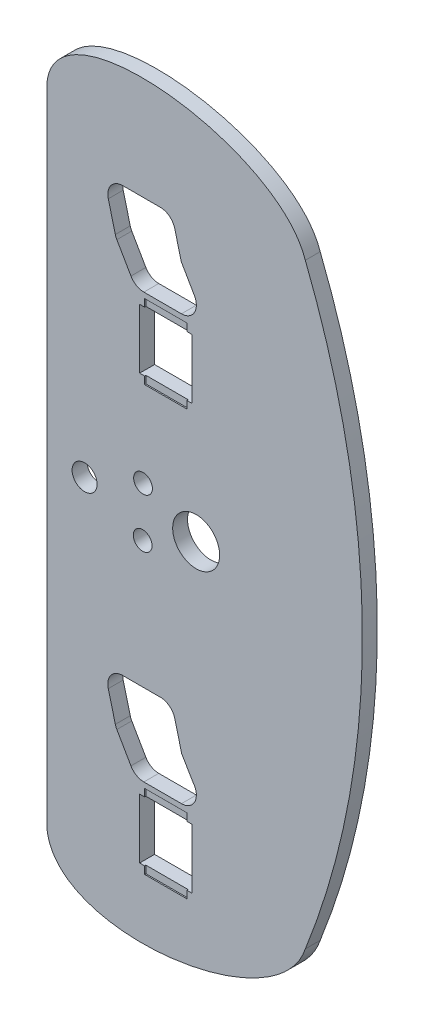
from build123d import *

# Parameters (mm, degrees)
SKETCH4_R           = 15.99946
BOSS_EXTRUDE6_DEPTH = 19.05
SKETCH5_W           = 53.975
SKETCH5_H           = 9.525
BOSS_EXTRUDE7_DEPTH = 17.4625


with BuildPart() as part:
    # Sketch4 → Boss-Extrude6 (new body)
    with BuildSketch(Plane.XY):
        with BuildLine():
            add(Edge.make_bspline(
                [(1691.296561672, 1789.049084222), (1656.762851887, 1894.057259265), (1371.325091688, 1929.801340936), (1361.096561672, 1819.73467427)],
                knots=[0, 0, 0, 0, 7.638294788, 7.638294788, 7.638294788, 7.638294788], degree=3))
            Line((1361.096561672, 1819.73467427), (1361.096561672, 996.363494174))
            add(Edge.make_bspline(
                [(1691.296561672, 1027.049084222), (1656.707719979, 922.059056278), (1371.325091688, 886.296827508), (1361.096561672, 996.363494174)],
                knots=[0, 0, 0, 0, 7.629784399, 7.629784399, 7.629784399, 7.629784399], degree=3))
            ThreePointArc((1691.296561672, 1027.049084222), (1764.258141615, 1408.049084222), (1691.296561672, 1789.049084222))
        make_face()
        Polygon((1540.03574179, 1016.394689719), (1540.03574179, 1006.869689719), (1486.06074179, 1006.869689719), (1486.06074179, 1016.394689719), (1479.71074179, 1016.394689719), (1479.71074179, 1092.594689719), (1486.06074179, 1092.594689719), (1486.06074179, 1102.119689719), (1540.03574179, 1102.119689719), (1540.03574179, 1092.594689719), (1546.38574179, 1092.594689719), (1546.38574179, 1016.394689719), align=None, mode=Mode.SUBTRACT)
        with Locations((1409.336846603, 1408.026574973)):
            Circle(SKETCH4_R, mode=Mode.SUBTRACT)
        with BuildLine():
            Line((1448.599054653, 1154.275509352), (1439.599047253, 1189.275439352))
            ThreePointArc((1439.599047253, 1189.275439352), (1443.530372909, 1206.353246717), (1459.747970005, 1212.993756507))
            Line((1459.747970005, 1212.993756507), (1504.349628175, 1212.993756507))
            ThreePointArc((1504.349628175, 1212.993756507), (1517.03821718, 1209.580352541), (1524.498550926, 1198.763928086))
            Line((1524.498550926, 1198.763928086), (1533.38304498, 1164.213215387))
            Line((1533.38304498, 1164.213215387), (1547.541432032, 1140.133610308))
            ThreePointArc((1547.541432032, 1140.133610308), (1549.470421095, 1137.425402166), (1550.899143934, 1134.423046225))
            ThreePointArc((1550.899143934, 1134.423046225), (1548.695609175, 1116.903353621), (1533.04876059, 1108.719752719))
            Line((1533.04876059, 1108.719752719), (1485.04883119, 1108.719752719))
            ThreePointArc((1485.04883119, 1108.719752719), (1475.515471645, 1111.276797987), (1468.54140154, 1118.261479145))
            Line((1468.54140154, 1118.261479145), (1450.54141214, 1149.511480145))
            ThreePointArc((1450.54141214, 1149.511480145), (1449.408667615, 1151.82762225), (1448.599054653, 1154.275509352))
        make_face(mode=Mode.SUBTRACT)
        with BuildLine():
            ThreePointArc((1474.249039335, 1382.82986805), (1487.5634975, 1386.490820341), (1495.508386902, 1375.196746661))
            ThreePointArc((1495.508386902, 1375.196746661), (1493.753510834, 1368.948751739), (1489.002147571, 1364.528166065))
            ThreePointArc((1489.002147571, 1364.528166065), (1474.165849455, 1367.665674107), (1474.249039335, 1382.82986805))
        make_face(mode=Mode.SUBTRACT)
        with BuildLine():
            ThreePointArc((1557.072797026, 1437.56647945), (1574.828377402, 1427.300768518), (1581.839149014, 1408.026574973))
            ThreePointArc((1581.839149014, 1408.026574973), (1575.084108836, 1389.061580054), (1557.86103224, 1378.637222393))
            ThreePointArc((1557.86103224, 1378.637222393), (1521.841952392, 1407.625332956), (1557.072797026, 1437.56647945))
        make_face(mode=Mode.SUBTRACT)
        with BuildLine():
            ThreePointArc((1488.875267229, 1449.649043045), (1494.050252402, 1445.222009203), (1495.982714685, 1438.691719032))
            ThreePointArc((1495.982714685, 1438.691719032), (1487.958037457, 1427.369315077), (1474.616578624, 1431.190015552))
            ThreePointArc((1474.616578624, 1431.190015552), (1474.486021487, 1446.027445206), (1488.875267229, 1449.649043045))
        make_face(mode=Mode.SUBTRACT)
        Polygon((1540.03574179, 1558.364897878), (1540.03574179, 1548.839897878), (1486.06074179, 1548.839897878), (1486.06074179, 1558.364897878), (1479.71074179, 1558.364897878), (1479.71074179, 1634.564897878), (1486.06074179, 1634.564897878), (1486.06074179, 1644.089897878), (1540.03574179, 1644.089897878), (1540.03574179, 1634.564897878), (1546.38574179, 1634.564897878), (1546.38574179, 1558.364897878), align=None, mode=Mode.SUBTRACT)
        with BuildLine():
            Line((1448.599054653, 1696.245717511), (1439.599047253, 1731.245647511))
            ThreePointArc((1439.599047253, 1731.245647511), (1442.994261078, 1747.663037229), (1458.04883439, 1755.039891878))
            Line((1458.04883439, 1755.039891878), (1506.04876379, 1755.039891878))
            ThreePointArc((1506.04876379, 1755.039891878), (1517.721909142, 1751.04446519), (1524.498550926, 1740.734136245))
            Line((1524.498550926, 1740.734136245), (1532.852004601, 1708.248574747))
            Line((1532.852004601, 1708.248574747), (1549.556190239, 1679.248234452))
            ThreePointArc((1549.556190239, 1679.248234452), (1549.541715322, 1660.206601333), (1533.04876059, 1650.689960878))
            Line((1533.04876059, 1650.689960878), (1485.04883119, 1650.689960878))
            ThreePointArc((1485.04883119, 1650.689960878), (1475.515471645, 1653.247006146), (1468.54140154, 1660.231687303))
            Line((1468.54140154, 1660.231687303), (1450.54141214, 1691.481688303))
            ThreePointArc((1450.54141214, 1691.481688303), (1449.408667615, 1693.797830408), (1448.599054653, 1696.245717511))
        make_face(mode=Mode.SUBTRACT)
    extrude(amount=BOSS_EXTRUDE6_DEPTH)

    # Sketch5 → Boss-Extrude7 (add)
    with BuildSketch(Plane.XY):
        with Locations((1513.04824179, 1011.632189719)):
            Rectangle(SKETCH5_W, SKETCH5_H)
        with Locations((1513.04824179, 1097.357189719)):
            Rectangle(SKETCH5_W, SKETCH5_H)
        with Locations((1513.04824179, 1553.602397878)):
            Rectangle(SKETCH5_W, SKETCH5_H)
        with Locations((1513.04824179, 1639.327397878)):
            Rectangle(SKETCH5_W, SKETCH5_H)
    extrude(amount=BOSS_EXTRUDE7_DEPTH)


solid = part.part
